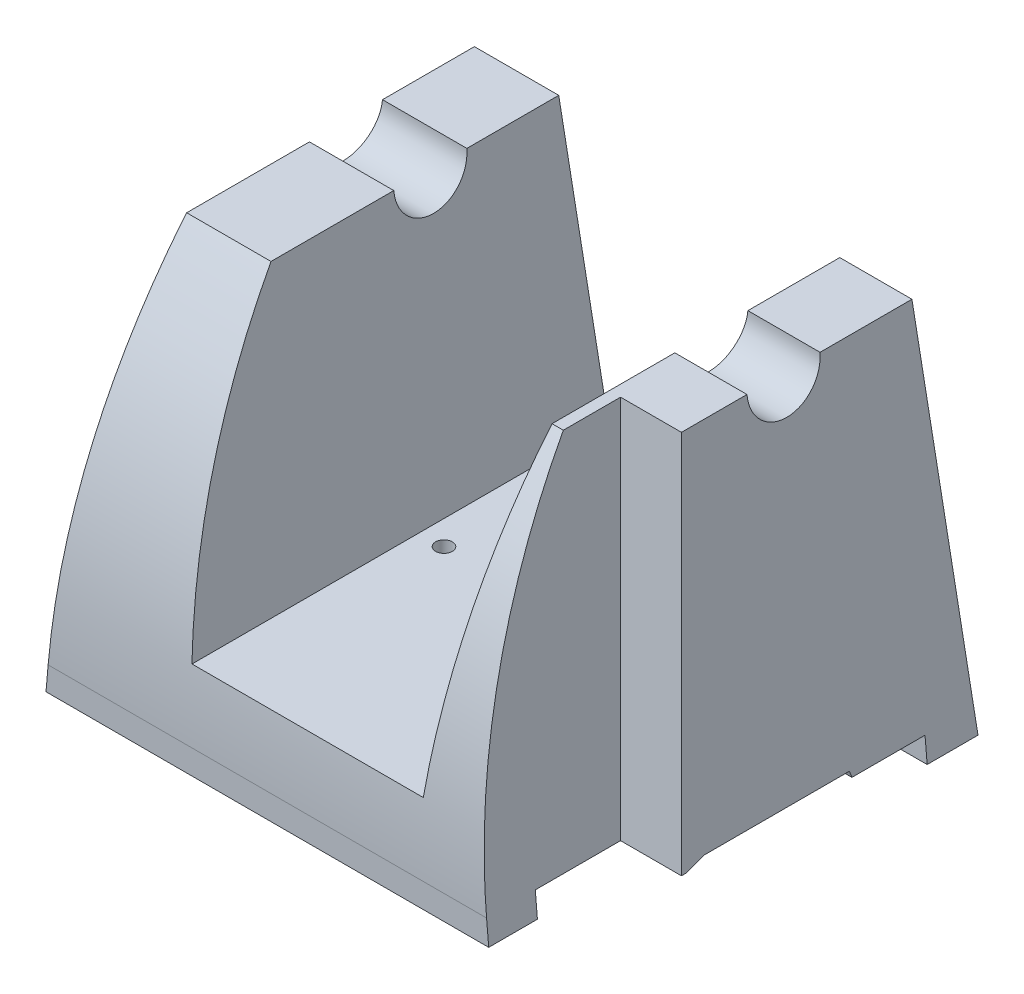
from build123d import *

# Parameters (mm, degrees)
BOSS_EXTRUDE1_DEPTH     = 130.175
CUT_EXTRUDE1_DEPTH      = 198.438033
CUT_EXTRUDE1_DEPTH_BACK = 198.438033
SKETCH2_W               = 57.15
SKETCH2_H               = 74.103907915
SKETCH3_W               = 15.875
SKETCH3_H               = 34.925
CUT_EXTRUDE2_DEPTH      = 198.438033
DRAFT1_ANGLE            = -5
CUT_EXTRUDE3_DEPTH      = 188.228236601
CUT_EXTRUDE3_DEPTH_BACK = 188.228236601
SKETCH4_R               = 2.178428953


with BuildPart() as part:
    # Sketch1 → Boss-Extrude1 (new body)
    with BuildSketch(Plane(origin=(0, 0, 0), x_dir=(0, 0, -1), z_dir=(1, 0, 0))):
        with BuildLine():
            Line((0, 0), (0, 6.35))
            ThreePointArc((0, 6.35), (7.170490025, 54.477745417), (28.059114221, 98.425))
            Line((28.059114221, 98.425), (60.067057111, 98.425))
            ThreePointArc((60.067057111, 98.425), (69.592057111, 88.9), (79.117057111, 98.425))
            Line((79.117057111, 98.425), (111.125, 98.425))
            Line((111.125, 98.425), (111.125, 0))
            Line((111.125, 0), (98.425, 0))
            Line((98.425, 0), (98.425, 6.35))
            Line((98.425, 6.35), (79.375, 6.35))
            Line((79.375, 6.35), (78.839467499, 7.9375))
            Line((78.839467499, 7.9375), (40.880795395, 7.9375))
            Line((40.880795395, 7.9375), (36.174906872, 6.35))
            Line((36.174906872, 6.35), (12.7, 6.35))
            Line((12.7, 6.35), (12.7, 0))
            Line((12.7, 0), (0, 0))
        make_face()
    extrude(amount=BOSS_EXTRUDE1_DEPTH)

    # Sketch2 → Cut-Extrude1 (cut, two sides: drawn at the far end of the back side and taken through both)
    with BuildSketch(Plane(origin=(0, 0, -111.125), x_dir=(-1, 0, 0), z_dir=(0, 0, -1)).offset(-CUT_EXTRUDE1_DEPTH_BACK)):
        with Locations((-66.675, 61.373046043)):
            Rectangle(SKETCH2_W, SKETCH2_H)
    extrude(amount=CUT_EXTRUDE1_DEPTH + CUT_EXTRUDE1_DEPTH_BACK, mode=Mode.SUBTRACT)

    # Sketch3 → Cut-Extrude2 (cut, through all)
    with BuildSketch(Plane(origin=(0, 98.425, 0), x_dir=(1, 0, 0), z_dir=(0, 1, 0))):
        with Locations((122.2375, 17.4625)):
            Rectangle(SKETCH3_W, SKETCH3_H)
    extrude(amount=-CUT_EXTRUDE2_DEPTH, mode=Mode.SUBTRACT)

    # Draft1
    draft1_faces = [part.faces().sort_by_distance(p)[0] for p in [
        (1.631962354, 49.2125, -111.125),
        (122.2375, 52.3875, -34.925),
        (130.175, 51.366021229, -73.60068913),
        (114.3, 42.899391588, -20.187689821),
        (95.25, 59.043863813, -60.63952827),
        (0, 49.133887707, -59.518940982),
        (38.1, 59.043863813, -60.63952827),
    ]]
    draft(draft1_faces, Plane(origin=(130.175, 6.35, -36.174906872), x_dir=(0, 0, -1), z_dir=(0, -1, 0)), DRAFT1_ANGLE)

    # Sketch4 → Cut-Extrude3 (cut, two sides: drawn at the far end of the back side and taken through both)
    with BuildSketch(Plane(origin=(0, 24.321092085, 0), x_dir=(1, 0, 0), z_dir=(0, 1, 0)).offset(-CUT_EXTRUDE3_DEPTH_BACK)):
        with Locations((42.869708487, 60.325)):
            Circle(SKETCH4_R)
    extrude(amount=CUT_EXTRUDE3_DEPTH + CUT_EXTRUDE3_DEPTH_BACK, mode=Mode.SUBTRACT)


solid = part.part
